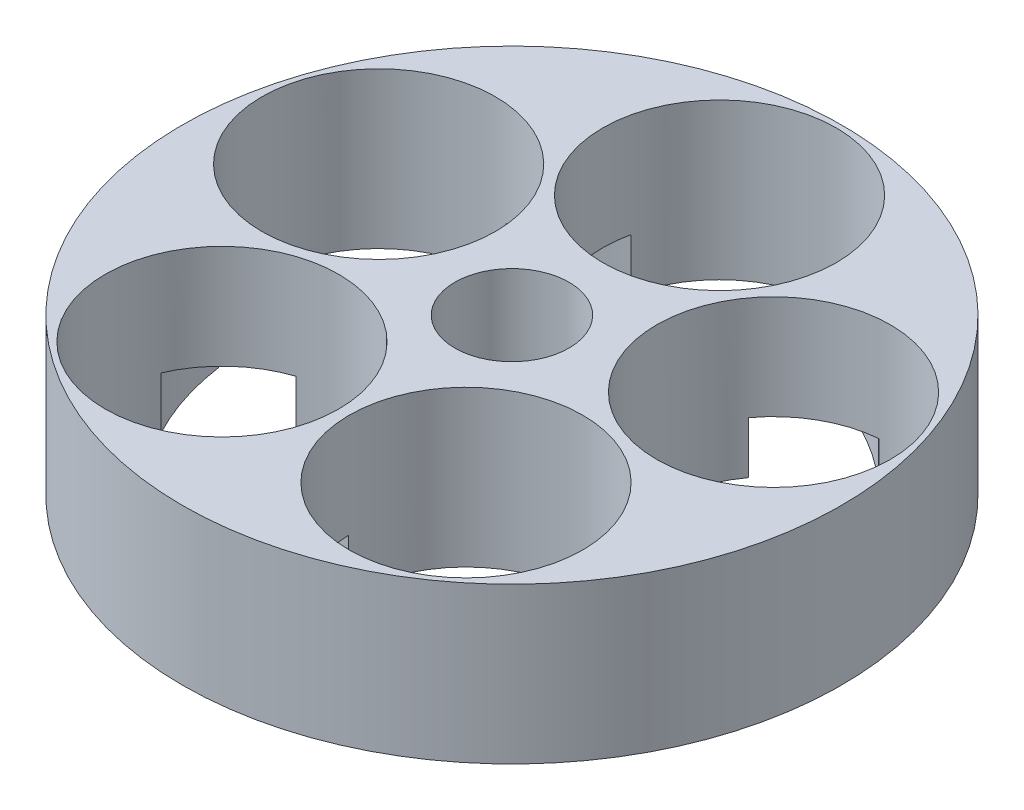
from build123d import *

# Parameters (mm, degrees)
SKETCH1_R           = 63.5
SKETCH1_R_2         = 22.5
SKETCH1_R_3         = 11
BOSS_EXTRUDE1_DEPTH = 30
CUT_EXTRUDE1_START  = -20
SKETCH2_R           = 50
SKETCH2_R_2         = 32.5
CUT_EXTRUDE1_DEPTH  = 20


with BuildPart() as part:
    # Sketch1 → Boss-Extrude1 (new body)
    with BuildSketch(Plane(origin=(0, 0, 0), x_dir=(1, 0, 0), z_dir=(0, 1, 0))):
        Circle(SKETCH1_R)
        with Locations((38.042260652, 12.360679775)):
            Circle(SKETCH1_R_2, mode=Mode.SUBTRACT)
        with Locations((0, 40)):
            Circle(SKETCH1_R_2, mode=Mode.SUBTRACT)
        with Locations((-38.042260652, 12.360679775)):
            Circle(SKETCH1_R_2, mode=Mode.SUBTRACT)
        with Locations((-23.511410092, -32.360679775)):
            Circle(SKETCH1_R_2, mode=Mode.SUBTRACT)
        with Locations((23.511410092, -32.360679775)):
            Circle(SKETCH1_R_2, mode=Mode.SUBTRACT)
        Circle(SKETCH1_R_3, mode=Mode.SUBTRACT)
    extrude(amount=BOSS_EXTRUDE1_DEPTH)

    # Sketch2 → Cut-Extrude1 (cut)
    with BuildSketch(Plane(origin=(0, 30, 0), x_dir=(1, 0, 0), z_dir=(0, 1, 0)).offset(CUT_EXTRUDE1_START)):
        Circle(SKETCH2_R)
        Circle(SKETCH2_R_2, mode=Mode.SUBTRACT)
    extrude(amount=-CUT_EXTRUDE1_DEPTH, mode=Mode.SUBTRACT)


solid = part.part
